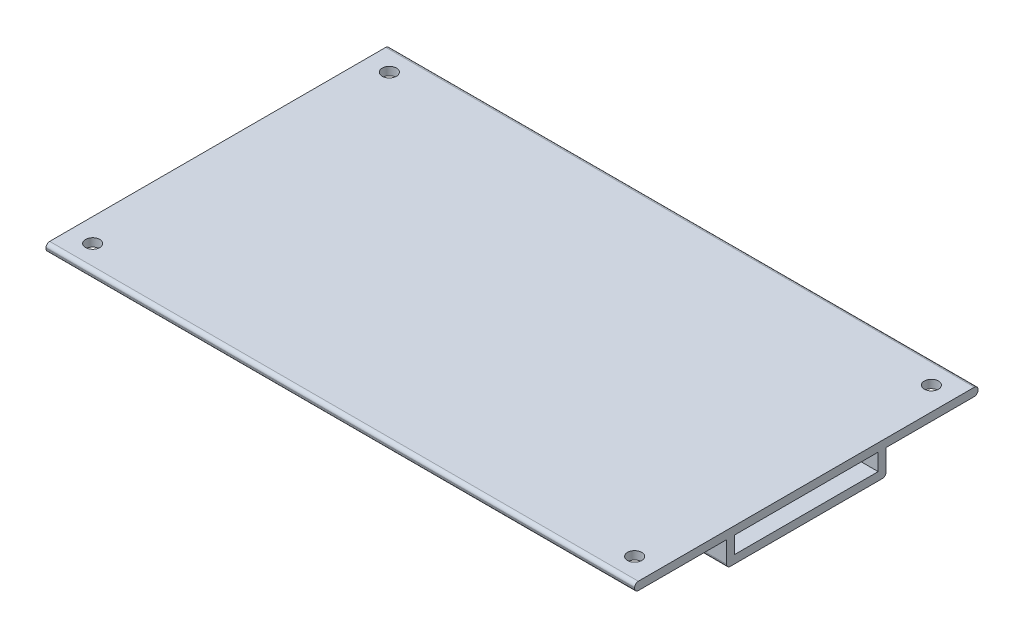
from build123d import *

# Parameters (mm, degrees)
SKETCH1_W           = 29.3
SKETCH1_H           = 3.44
BOSS_EXTRUDE1_DEPTH = 120
FILLET1_R           = 0.75
CUT_EXTRUDE1_REACH  = 127.183
SKETCH2_R           = 1.45


with BuildPart() as part:
    # Sketch1 → Boss-Extrude1 (new body)
    with BuildSketch(Plane(origin=(0, 0, 0), x_dir=(0, 0, -1), z_dir=(1, 0, 0))):
        Polygon((-16.25, 0), (-16.25, 5.1), (-35, 5.1), (-35, 6.76), (35, 6.76), (35, 5.1), (16.25, 5.1), (16.25, 0), align=None)
        with Locations((0, 3.38)):
            Rectangle(SKETCH1_W, SKETCH1_H, mode=Mode.SUBTRACT)
    extrude(amount=BOSS_EXTRUDE1_DEPTH)

    # Fillet1
    fillet1_edges = [part.edges().sort_by_distance(p)[0] for p in [
        (60, 0, -16.25),
        (60, 0, 16.25),
        (60, 5.1, -35),
        (60, 6.76, -35),
        (60, 5.1, 35),
        (60, 6.76, 35),
    ]]
    fillet(fillet1_edges, radius=FILLET1_R)

    # Sketch2 → Cut-Extrude1 (cut, up to next)
    with BuildSketch(Plane(origin=(0, 6.76, 0), x_dir=(1, 0, 0), z_dir=(0, 1, 0)), mode=Mode.PRIVATE) as cut_extrude1_sk1:
        with Locations((115.25, 30.25)):
            Circle(SKETCH2_R)
    cut_extrude1_tool1 = extrude(cut_extrude1_sk1.sketch, amount=-CUT_EXTRUDE1_REACH, mode=Mode.PRIVATE) & part.part
    # Sketch2 → Cut-Extrude1 (cut, up to next)
    with BuildSketch(Plane(origin=(0, 6.76, 0), x_dir=(1, 0, 0), z_dir=(0, 1, 0)), mode=Mode.PRIVATE) as cut_extrude1_sk2:
        with Locations((4.75, 30.25)):
            Circle(SKETCH2_R)
    cut_extrude1_tool2 = extrude(cut_extrude1_sk2.sketch, amount=-CUT_EXTRUDE1_REACH, mode=Mode.PRIVATE) & part.part
    # Sketch2 → Cut-Extrude1 (cut, up to next)
    with BuildSketch(Plane(origin=(0, 6.76, 0), x_dir=(1, 0, 0), z_dir=(0, 1, 0)), mode=Mode.PRIVATE) as cut_extrude1_sk3:
        with Locations((4.75, -30.25)):
            Circle(SKETCH2_R)
    cut_extrude1_tool3 = extrude(cut_extrude1_sk3.sketch, amount=-CUT_EXTRUDE1_REACH, mode=Mode.PRIVATE) & part.part
    # Sketch2 → Cut-Extrude1 (cut, up to next)
    with BuildSketch(Plane(origin=(0, 6.76, 0), x_dir=(1, 0, 0), z_dir=(0, 1, 0)), mode=Mode.PRIVATE) as cut_extrude1_sk4:
        with Locations((115.25, -30.25)):
            Circle(SKETCH2_R)
    cut_extrude1_tool4 = extrude(cut_extrude1_sk4.sketch, amount=-CUT_EXTRUDE1_REACH, mode=Mode.PRIVATE) & part.part
    add(cut_extrude1_tool1.solids().sort_by_distance((115.25, 6.76, -30.25))[0], mode=Mode.SUBTRACT)
    add(cut_extrude1_tool2.solids().sort_by_distance((4.75, 6.76, -30.25))[0], mode=Mode.SUBTRACT)
    add(cut_extrude1_tool3.solids().sort_by_distance((4.75, 6.76, 30.25))[0], mode=Mode.SUBTRACT)
    add(cut_extrude1_tool4.solids().sort_by_distance((115.25, 6.76, 30.25))[0], mode=Mode.SUBTRACT)


solid = part.part
